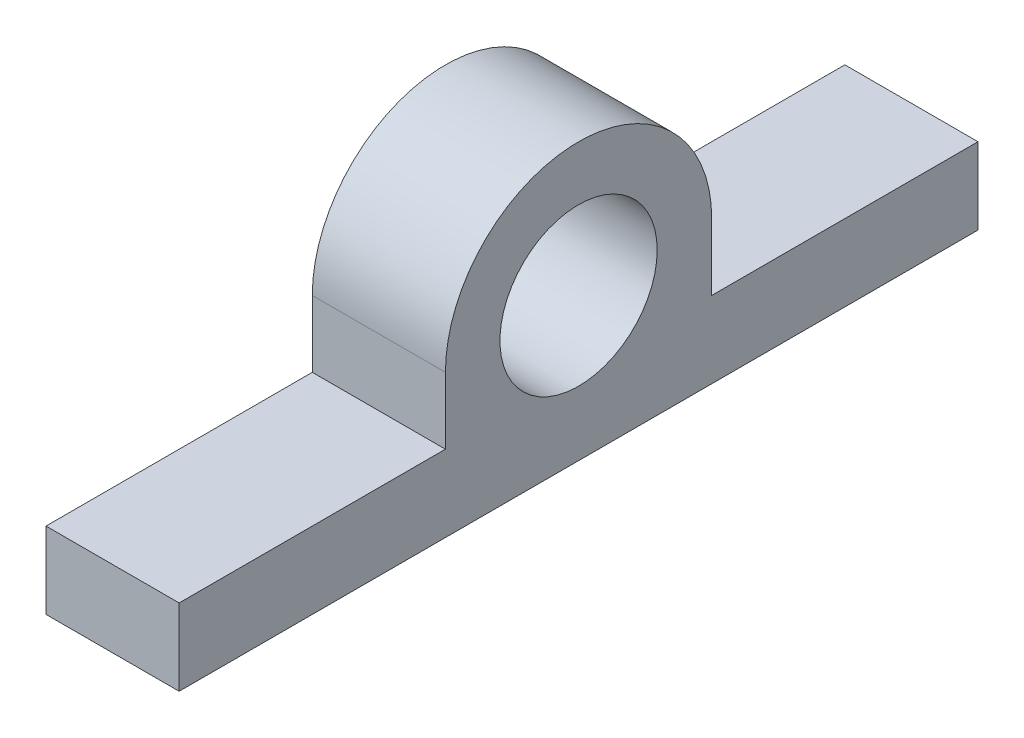
from build123d import *

# Parameters (mm, degrees)
BOSS_EXTRUDE1_DEPTH = 12.7
SKETCH2_R           = 7.5
CUT_EXTRUDE1_DEPTH  = 82.621397317
SKETCH3_R           = 2
CUT_EXTRUDE2_DEPTH  = 7


with BuildPart() as part:
    # Sketch1 → Boss-Extrude1 (new body)
    with BuildSketch(Plane(origin=(0, 0, 0), x_dir=(0, 0, -1), z_dir=(1, 0, 0))):
        with BuildLine():
            Line((0, 0), (76.2, 0))
            Line((76.2, 0), (76.2, 7.3))
            Line((76.2, 7.3), (50.8, 7.3))
            Line((50.8, 7.3), (50.8, 13.65))
            ThreePointArc((50.8, 13.65), (38.1, 26.35), (25.4, 13.65))
            Line((25.4, 13.65), (25.4, 7.3))
            Line((25.4, 7.3), (0, 7.3))
            Line((0, 7.3), (0, 0))
        make_face()
    extrude(amount=BOSS_EXTRUDE1_DEPTH)

    # Sketch2 → Cut-Extrude1 (cut, through all)
    with BuildSketch(Plane(origin=(12.7, 0, 0), x_dir=(0, 0, -1), z_dir=(1, 0, 0))):
        with Locations((38.1, 13.65)):
            Circle(SKETCH2_R)
    extrude(amount=-CUT_EXTRUDE1_DEPTH, mode=Mode.SUBTRACT)

    # Sketch3 → Cut-Extrude2 (cut)
    with BuildSketch(Plane.XZ):
        with Locations((6.35, -12.7)):
            Circle(SKETCH3_R)
        with Locations((6.35, -63.5)):
            Circle(SKETCH3_R)
    extrude(amount=-CUT_EXTRUDE2_DEPTH, mode=Mode.SUBTRACT)


solid = part.part
